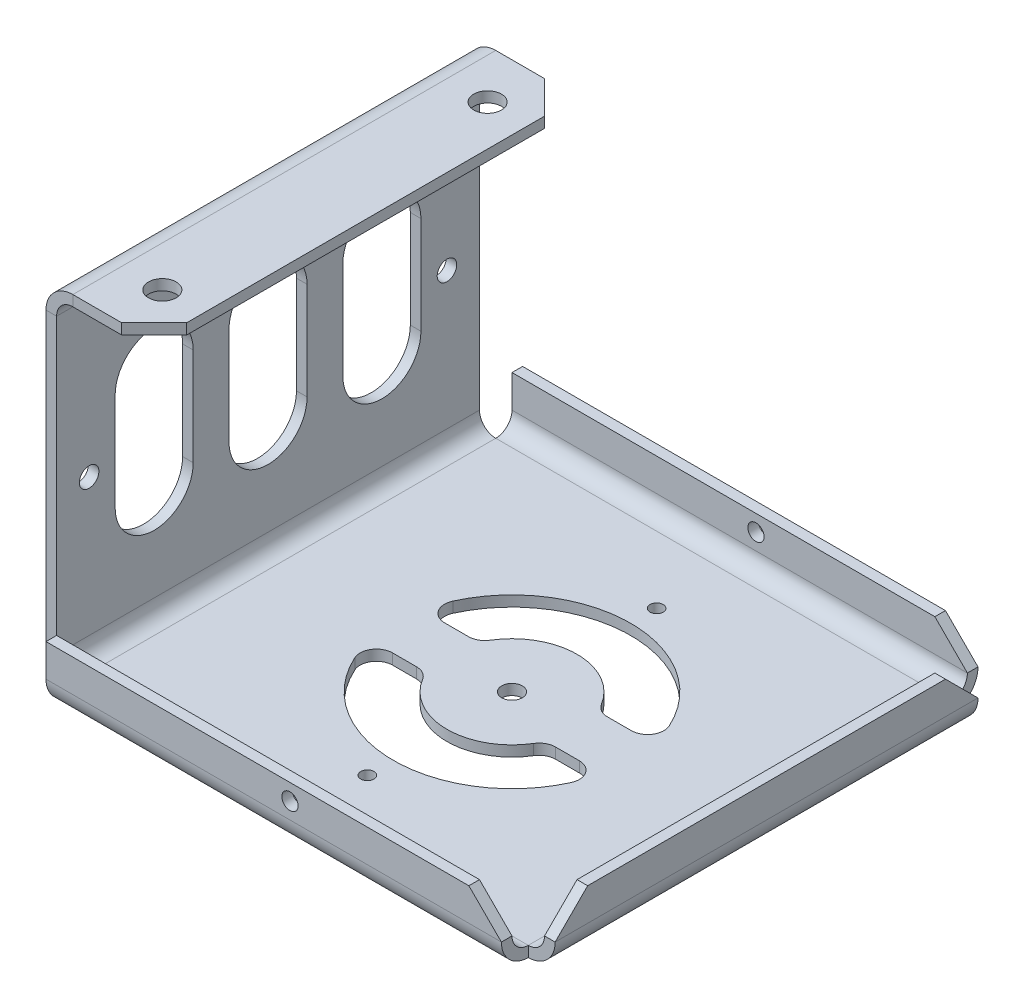
from build123d import *

# Parameters (mm, degrees)
BASE_FLANGE1_START      = -65
BASE_FLANGE1_DEPTH      = 130
CUT_EXTRUDE1_DEPTH      = 10
SKETCH4_R               = 4.25
CUT_EXTRUDE2_DEPTH      = 10
SKETCH5_R               = 3.175
SKETCH5_R_2             = 2.032
CUT_EXTRUDE3_DEPTH      = 10
CUT_EXTRUDE4_DEPTH      = 10
CHAMFER1_SIZE           = 10
EDGE_FLANGE1_DEPTH      = 140
EDGE_FLANGE1_BEND_DEPTH = 140
FILLET1_R               = 5
CHAMFER2_SIZE           = 10
SKETCH13_R              = 3
CUT_EXTRUDE5_DEPTH      = 10
SKETCH14_R              = 2.5
CUT_EXTRUDE6_DEPTH      = 236.837583095


# Read off the part's stored shape, not the designer's step: Base-Flange1
# Sheet-metal steps are written as plain solids
with BuildPart() as part:
    # Base-Flange1 outline → Base-Flange1 (new body)
    with BuildSketch(Plane.XY.offset(BASE_FLANGE1_START)):
        with BuildLine():
            Line((153.26, 5), (153.26, 15))
            Line((153.26, 15), (150, 15))
            Line((150, 15), (150, 5))
            ThreePointArc((150, 5), (148.535533906, 1.464466094), (145, 0))
            Line((145, 0), (5, 0))
            ThreePointArc((5, 0), (1.464466094, 1.464466094), (0, 5))
            Line((0, 5), (0, 95))
            ThreePointArc((0, 95), (1.464466094, 98.535533906), (5, 100))
            Line((5, 100), (30, 100))
            Line((30, 100), (30, 103.26))
            Line((30, 103.26), (5, 103.26))
            ThreePointArc((5, 103.26), (-0.840702013, 100.840702013), (-3.26, 95))
            Line((-3.26, 95), (-3.26, 5))
            ThreePointArc((-3.26, 5), (-0.840702013, -0.840702013), (5, -3.26))
            Line((5, -3.26), (145, -3.26))
            ThreePointArc((145, -3.26), (150.840702013, -0.840702013), (153.26, 5))
        make_face()
    extrude(amount=BASE_FLANGE1_DEPTH)

    # Sketch3 → Cut-Extrude1 (cut)
    with BuildSketch(Plane.ZY.offset(3.26)):
        with BuildLine():
            Line((-47, 35), (-47, 65))
            ThreePointArc((-47, 65), (-35, 77), (-23, 65))
            Line((-23, 65), (-23, 35))
            ThreePointArc((-23, 35), (-35, 23), (-47, 35))
        make_face()
        with BuildLine():
            Line((47, 35), (47, 65))
            ThreePointArc((47, 65), (35, 77), (23, 65))
            Line((23, 65), (23, 35))
            ThreePointArc((23, 35), (35, 23), (47, 35))
        make_face()
        with BuildLine():
            Line((12, 65), (12, 35))
            ThreePointArc((12, 35), (0, 23), (-12, 35))
            Line((-12, 35), (-12, 65))
            ThreePointArc((-12, 65), (0, 77), (12, 65))
        make_face()
    extrude(amount=-CUT_EXTRUDE1_DEPTH, mode=Mode.SUBTRACT)

    # Sketch4 → Cut-Extrude2 (cut)
    with BuildSketch(Plane(origin=(0, 103.26, 0), x_dir=(1, 0, 0), z_dir=(0, 1, 0))):
        with Locations(Location((17.5, 50, 0), (0, 0, 270))):
            Circle(SKETCH4_R)
        with Locations(Location((17.5, -50, 0), (0, 0, 270))):
            Circle(SKETCH4_R)
    extrude(amount=-CUT_EXTRUDE2_DEPTH, mode=Mode.SUBTRACT)

    # Sketch5 → Cut-Extrude3 (cut)
    with BuildSketch(Plane(origin=(0, 0, 0), x_dir=(1, 0, 0), z_dir=(0, 1, 0))):
        with Locations(Location((75, 0, 0), (0, 0, 270))):
            Circle(SKETCH5_R)
        with Locations(Location((75, 44.45, 0), (0, 0, 270))):
            Circle(SKETCH5_R_2)
        with Locations(Location((75, -44.45, 0), (0, 0, 270))):
            Circle(SKETCH5_R_2)
    extrude(amount=-CUT_EXTRUDE3_DEPTH, mode=Mode.SUBTRACT)

    # Sketch6 → Cut-Extrude4 (cut)
    with BuildSketch(Plane(origin=(0, 0, 0), x_dir=(1, 0, 0), z_dir=(0, 1, 0))):
        with BuildLine():
            Line((39.387502194, 8), (56.66969722, 8))
            ThreePointArc((56.66969722, 8), (75, 20), (93.33030278, 8))
            Line((93.33030278, 8), (110.612497806, 8))
            ThreePointArc((110.612497806, 8), (75, 36.5), (39.387502194, 8))
        make_face()
        with BuildLine():
            Line((110.612497806, -8), (93.33030278, -8))
            ThreePointArc((93.33030278, -8), (75, -20), (56.66969722, -8))
            Line((56.66969722, -8), (39.387502194, -8))
            ThreePointArc((39.387502194, -8), (75, -36.5), (110.612497806, -8))
        make_face()
    extrude(amount=-CUT_EXTRUDE4_DEPTH, mode=Mode.SUBTRACT)

    # Chamfer1
    chamfer1_edges = [part.edges().sort_by_distance(p)[0] for p in [
        (151.63, 15, -65),
        (151.63, 15, 65),
        (30, 101.63, -65),
        (30, 101.63, 65),
    ]]
    chamfer(chamfer1_edges, length=CHAMFER1_SIZE)

    # Edge-Flange1 section (across the edge) → Edge-Flange1 (add)
    with BuildSketch(Plane(origin=(5, 0, 70), x_dir=(0, 0, -1), z_dir=(1, 0, 0))):
        with BuildLine():
            Line((-3.26, 5), (-3.26, 15))
            Line((-3.26, 15), (0, 15))
            Line((0, 15), (0, 5))
            ThreePointArc((0, 5), (1.464466094, 1.464466094), (5, 0))
            Line((5, 0), (5, -3.26))
            ThreePointArc((5, -3.26), (-0.840702013, -0.840702013), (-3.26, 5))
        make_face()
    extrude(amount=EDGE_FLANGE1_DEPTH)

    # Edge-Flange1 section 2 (across the edge) → Edge-Flange1 bend (add)
    with BuildSketch(Plane(origin=(145, 0, -70), x_dir=(0, 0, 1), z_dir=(-1, 0, 0))):
        with BuildLine():
            Line((-3.26, 5), (-3.26, 15))
            Line((-3.26, 15), (0, 15))
            Line((0, 15), (0, 5))
            ThreePointArc((0, 5), (1.464466094, 1.464466094), (5, 0))
            Line((5, 0), (5, -3.26))
            ThreePointArc((5, -3.26), (-0.840702013, -0.840702013), (-3.26, 5))
        make_face()
    extrude(amount=EDGE_FLANGE1_BEND_DEPTH)

    # Fillet1
    fillet1_edges = [part.edges().sort_by_distance(p)[0] for p in [
        (56.66969722, -1.63, 8),
        (93.33030278, -1.63, 8),
        (110.612497806, -1.63, 8),
        (39.387502194, -1.63, 8),
        (93.33030278, -1.63, -8),
        (56.66969722, -1.63, -8),
        (39.387502194, -1.63, -8),
        (110.612497806, -1.63, -8),
    ]]
    fillet(fillet1_edges, radius=FILLET1_R)

    # Chamfer2
    chamfer2_edges = [part.edges().sort_by_distance(p)[0] for p in [
        (145, 15, -71.63),
        (145, 15, 71.63),
    ]]
    chamfer(chamfer2_edges, length=CHAMFER2_SIZE)

    # Sketch13 → Cut-Extrude5 (cut)
    with BuildSketch(Plane(origin=(0, 0, 0), x_dir=(0, 0, -1), z_dir=(1, 0, 0))):
        with Locations((-55, 47.196639222)):
            Circle(SKETCH13_R)
        with Locations((55, 47.196639222)):
            Circle(SKETCH13_R)
    extrude(amount=-CUT_EXTRUDE5_DEPTH, mode=Mode.SUBTRACT)

    # Sketch14 → Cut-Extrude6 (cut, through all)
    with BuildSketch(Plane.XY.offset(73.26)):
        with Locations((80, 10)):
            Circle(SKETCH14_R)
    extrude(amount=-CUT_EXTRUDE6_DEPTH, mode=Mode.SUBTRACT)


solid = part.part
